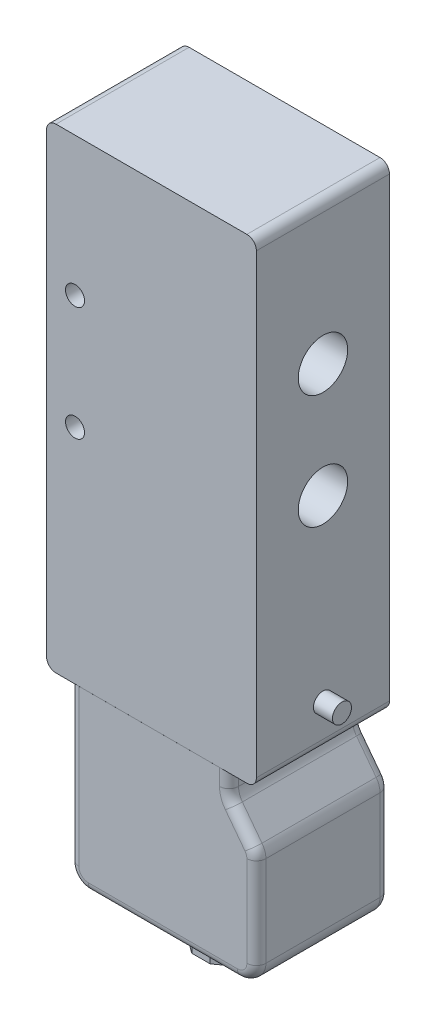
from build123d import *

# Parameters (mm, degrees)
SKETCH2_W           = 35.052
SKETCH2_H           = 79.375
BOSS_EXTRUDE1_DEPTH = 22.225
SKETCH3_R           = 1.5875
BOSS_EXTRUDE2_DEPTH = 3.175
BOSS_EXTRUDE4_DEPTH = 22.225
FILLET2_R           = 3.175
BOSS_EXTRUDE5_DEPTH = 0.00254
BOSS_EXTRUDE6_START = 0.00254
BOSS_EXTRUDE6_DEPTH = 0.00254
BOSS_EXTRUDE7_DEPTH = 6.35
SKETCH8_R           = 7.441189758
SKETCH8_R_2         = 3.175
CUT_EXTRUDE2_DEPTH  = 1.5875
FILLET3_R           = 1.5875
FILLET5_R           = 1.5875
SKETCH9_R           = 4.1275
CUT_EXTRUDE3_DEPTH  = 6.858
SKETCH10_R          = 4.1275
CUT_EXTRUDE4_DEPTH  = 6.858
SKETCH11_R          = 1.5875
CUT_EXTRUDE5_DEPTH  = 91.861200127


with BuildPart() as part:
    # Sketch2 → Boss-Extrude1 (new body)
    with BuildSketch(Plane.XY):
        with Locations((17.526, 39.6875)):
            Rectangle(SKETCH2_W, SKETCH2_H)
    extrude(amount=BOSS_EXTRUDE1_DEPTH)

    # Sketch3 → Boss-Extrude2 (add)
    with BuildSketch(Plane(origin=(35.052, 0, 0), x_dir=(0, 0, -1), z_dir=(1, 0, 0))):
        with Locations(Location((-11.1125, 6.985, 0), (0, 0, 180))):
            Circle(SKETCH3_R)
    extrude(amount=BOSS_EXTRUDE2_DEPTH)

    # Sketch4 → Boss-Extrude4 (add)
    with BuildSketch(Plane.XY.offset(22.225)):
        Polygon((30.48, -3.81), (30.48, 0), (29.21, 0), (3.81, 0), (3.81, -29.21), (35.052, -29.21), (35.052, -9.836099718), align=None)
    extrude(amount=-BOSS_EXTRUDE4_DEPTH)

    # Fillet2
    fillet2_edges = [part.edges().sort_by_distance(p)[0] for p in [
        (30.48, -3.81, 11.1125),
        (35.052, -9.836099718, 11.1125),
        (35.052, -29.21, 11.1125),
        (3.81, -29.21, 11.1125),
    ]]
    fillet(fillet2_edges, radius=FILLET2_R)

    # Sketch5 → Boss-Extrude5 (add)
    with BuildSketch(Plane.XY.offset(22.225)):
        with BuildLine():
            Line((3.81, 0), (30.48, 0))
            Line((30.48, 0), (30.48, -2.741877551))
            ThreePointArc((30.48, -2.741877551), (30.64572555, -3.754247187), (31.125601437, -4.660931461))
            Line((31.125601437, -4.660931461), (34.406398563, -8.985168257))
            ThreePointArc((34.406398563, -8.985168257), (34.88627445, -9.891852531), (35.052, -10.904222168))
            Line((35.052, -10.904222168), (35.052, -26.035))
            ThreePointArc((35.052, -26.035), (34.12206403, -28.28006403), (31.877, -29.21))
            Line((31.877, -29.21), (6.985, -29.21))
            ThreePointArc((6.985, -29.21), (4.73993597, -28.28006403), (3.81, -26.035))
            Line((3.81, -26.035), (3.81, 0))
        make_face()
    extrude(amount=BOSS_EXTRUDE5_DEPTH)

    # Sketch6 → Boss-Extrude6 (add)
    with BuildSketch(Plane(origin=(0, 0, 0), x_dir=(-1, 0, 0), z_dir=(0, 0, -1)).offset(BOSS_EXTRUDE6_START)):
        with BuildLine():
            Line((-30.48, 0), (-3.81, 0))
            Line((-3.81, 0), (-3.81, -26.035))
            ThreePointArc((-3.81, -26.035), (-4.73993597, -28.28006403), (-6.985, -29.21))
            Line((-6.985, -29.21), (-31.877, -29.21))
            ThreePointArc((-31.877, -29.21), (-34.12206403, -28.28006403), (-35.052, -26.035))
            Line((-35.052, -26.035), (-35.052, -10.904222168))
            ThreePointArc((-35.052, -10.904222168), (-34.88627445, -9.891852531), (-34.406398563, -8.985168257))
            Line((-34.406398563, -8.985168257), (-31.125601437, -4.660931461))
            ThreePointArc((-31.125601437, -4.660931461), (-30.64572555, -3.754247187), (-30.48, -2.741877551))
            Line((-30.48, -2.741877551), (-30.48, 0))
        make_face()
    extrude(amount=-BOSS_EXTRUDE6_DEPTH)

    # Sketch7 → Boss-Extrude7 (add)
    with BuildSketch(Plane.XZ.offset(29.21)):
        Polygon((17.890627537, 15.85327897), (15.398252537, 14.042462536), (14.44625, 11.1125), (15.398252537, 8.182537464), (17.890627537, 6.37172103), (20.971372463, 6.37172103), (23.463747463, 8.182537464), (24.41575, 11.1125), (23.463747463, 14.042462536), (20.971372463, 15.85327897), align=None)
    extrude(amount=BOSS_EXTRUDE7_DEPTH)

    # Sketch8 → Cut-Extrude2 (cut)
    # profile 1 of 2: a face of its own
    with BuildSketch(Plane.XZ.offset(29.21)):
        with Locations((19.431, 11.1125)):
            Circle(SKETCH8_R)
        Polygon((14.44625, 11.1125), (15.398252537, 14.042462536), (17.890627537, 15.85327897), (20.971372463, 15.85327897), (23.463747463, 14.042462536), (24.41575, 11.1125), (23.463747463, 8.182537464), (20.971372463, 6.37172103), (17.890627537, 6.37172103), (15.398252537, 8.182537464), align=None, mode=Mode.SUBTRACT)
    # profile 2 of 2: a face of its own
    with BuildSketch(Plane.XZ.offset(29.21)):
        Polygon((15.398252537, 14.042462536), (17.890627537, 15.85327897), (20.971372463, 15.85327897), (23.463747463, 14.042462536), (24.41575, 11.1125), (23.463747463, 8.182537464), (20.971372463, 6.37172103), (17.890627537, 6.37172103), (15.398252537, 8.182537464), (14.44625, 11.1125), align=None)
        with Locations(Location((19.431, 11.1125, 0), (0, 0, 270))):
            Circle(SKETCH8_R_2, mode=Mode.SUBTRACT)
    extrude(amount=CUT_EXTRUDE2_DEPTH, mode=Mode.SUBTRACT)

    # Fillet3
    fillet3_edges = [part.edges().sort_by_distance(p)[0] for p in [
        (0, 79.375, 11.1125),
        (35.052, 79.375, 11.1125),
        (35.052, 0, 11.1125),
        (0, 0, 11.1125),
    ]]
    fillet(fillet3_edges, radius=FILLET3_R)

    # Fillet5
    # the kernel refuses this fillet: 1.5875 mm, written as the material it takes off along each edge
    with BuildSketch(Plane(origin=(30.48, -2.741877551, -0.00254), x_dir=(0, 0, 1), z_dir=(0, 1, 0)), Plane(origin=(30.48, 0, 22.22754), x_dir=(0, 0, -1), z_dir=(0, -1, 0))) as fillet5_piece_1:
        with BuildLine():
            CenterArc((FILLET5_R, -FILLET5_R), FILLET5_R, 90, 90)
            Line((0, -FILLET5_R), (0, 0))
            Line((0, 0), (FILLET5_R, 0))
        make_face()
    extrude(amount=2.741877551, mode=Mode.SUBTRACT)
    with BuildSketch(Plane(origin=(33.655, -2.741877551, -0.00254), x_dir=(-0.7966609646289196, -0.6044264284729114, 0), z_dir=(0.6044264284729114, -0.7966609646289196, 0))) as fillet5_piece_2:
        with BuildLine():
            CenterArc((3.175 + FILLET5_R, -FILLET5_R), FILLET5_R, 90, 90)
            Line((3.175, -FILLET5_R), (3.175, 0))
            Line((3.175, 0), (3.175 + FILLET5_R, 0))
        make_face()
    revolve(axis=Axis((33.655, -2.741877551, -0.00254), (0, 0, -1)), revolution_arc=37.18757939, mode=Mode.SUBTRACT)
    with BuildSketch(Plane(origin=(34.406398563, -8.985168257, -0.00254), x_dir=(-0.796660964628914, -0.6044264284729185, 0), z_dir=(-0.6044264284729186, 0.7966609646289141, 0)), Plane(origin=(31.125601437, -4.660931461, 22.22754), x_dir=(-0.7966609646289139, -0.6044264284729186, 0), z_dir=(0.6044264284729186, -0.796660964628914, 0))) as fillet5_piece_3:
        with BuildLine():
            CenterArc((FILLET5_R, FILLET5_R), FILLET5_R, 180, 90)
            Line((0, FILLET5_R), (0, 0))
            Line((0, 0), (FILLET5_R, 0))
        make_face()
    extrude(amount=5.427951146, mode=Mode.SUBTRACT)
    with BuildSketch(Plane(origin=(31.877, -10.904222168, -0.00254), x_dir=(1, 0, 0), z_dir=(0, -1, 0))) as fillet5_piece_4:
        with BuildLine():
            CenterArc((3.175 - FILLET5_R, FILLET5_R), FILLET5_R, 270, 90)
            Line((3.175, FILLET5_R), (3.175, 0))
            Line((3.175, 0), (3.175 - FILLET5_R, 0))
        make_face()
    revolve(axis=Axis((31.877, -10.904222168, -0.00254), (0, 0, 1)), revolution_arc=37.18757939, mode=Mode.SUBTRACT)
    with BuildSketch(Plane(origin=(35.052, -26.035, -0.00254), x_dir=(-1, 0, 0), z_dir=(0, 1, 0)), Plane(origin=(35.052, -10.904222168, 22.22754), x_dir=(-1, 0, 0), z_dir=(0, -1, 0))) as fillet5_piece_5:
        with BuildLine():
            CenterArc((FILLET5_R, FILLET5_R), FILLET5_R, 180, 90)
            Line((0, FILLET5_R), (0, 0))
            Line((0, 0), (FILLET5_R, 0))
        make_face()
    extrude(amount=15.130777832, mode=Mode.SUBTRACT)
    with BuildSketch(Plane(origin=(31.877, -26.035, -0.00254), x_dir=(0, -1, 0), z_dir=(-1, 0, 0))) as fillet5_piece_6:
        with BuildLine():
            CenterArc((3.175 - FILLET5_R, FILLET5_R), FILLET5_R, 270, 90)
            Line((3.175, FILLET5_R), (3.175, 0))
            Line((3.175, 0), (3.175 - FILLET5_R, 0))
        make_face()
    revolve(axis=Axis((31.877, -26.035, -0.00254), (0, 0, 1)), revolution_arc=90, mode=Mode.SUBTRACT)
    with BuildSketch(Plane(origin=(6.985, -29.21, -0.00254), x_dir=(0, 1, 0), z_dir=(1, 0, 0)), Plane(origin=(31.877, -29.21, 22.22754), x_dir=(0, 1, 0), z_dir=(-1, 0, 0))) as fillet5_piece_7:
        with BuildLine():
            CenterArc((FILLET5_R, FILLET5_R), FILLET5_R, 180, 90)
            Line((0, FILLET5_R), (0, 0))
            Line((0, 0), (FILLET5_R, 0))
        make_face()
    extrude(amount=24.892, mode=Mode.SUBTRACT)
    with BuildSketch(Plane(origin=(6.985, -26.035, -0.00254), x_dir=(-1, 0, 0), z_dir=(0, 1, 0))) as fillet5_piece_8:
        with BuildLine():
            CenterArc((3.175 - FILLET5_R, FILLET5_R), FILLET5_R, 270, 90)
            Line((3.175, FILLET5_R), (3.175, 0))
            Line((3.175, 0), (3.175 - FILLET5_R, 0))
        make_face()
    revolve(axis=Axis((6.985, -26.035, -0.00254), (0, 0, 1)), revolution_arc=90, mode=Mode.SUBTRACT)
    with BuildSketch(Plane(origin=(3.81, 0, -0.00254), x_dir=(0, 0, 1), z_dir=(0, -1, 0)), Plane(origin=(3.81, -26.035, 22.22754), x_dir=(0, 0, -1), z_dir=(0, 1, 0))) as fillet5_piece_9:
        with BuildLine():
            CenterArc((FILLET5_R, -FILLET5_R), FILLET5_R, 90, 90)
            Line((0, -FILLET5_R), (0, 0))
            Line((0, 0), (FILLET5_R, 0))
        make_face()
    extrude(amount=26.035, mode=Mode.SUBTRACT)
    with BuildSketch(Plane(origin=(6.985, -26.035, 22.22754), x_dir=(0, -1, 0), z_dir=(1, 0, 0))) as fillet5_piece_10:
        with BuildLine():
            CenterArc((3.175 - FILLET5_R, FILLET5_R), FILLET5_R, 270, 90)
            Line((3.175, FILLET5_R), (3.175, 0))
            Line((3.175, 0), (3.175 - FILLET5_R, 0))
        make_face()
    revolve(axis=Axis((6.985, -26.035, 22.22754), (0, 0, -1)), revolution_arc=90, mode=Mode.SUBTRACT)
    with BuildSketch(Plane(origin=(31.877, -26.035, 22.22754), x_dir=(1, 0, 0), z_dir=(0, 1, 0))) as fillet5_piece_11:
        with BuildLine():
            CenterArc((3.175 - FILLET5_R, FILLET5_R), FILLET5_R, 270, 90)
            Line((3.175, FILLET5_R), (3.175, 0))
            Line((3.175, 0), (3.175 - FILLET5_R, 0))
        make_face()
    revolve(axis=Axis((31.877, -26.035, 22.22754), (0, 0, -1)), revolution_arc=90, mode=Mode.SUBTRACT)
    with BuildSketch(Plane(origin=(31.877, -10.904222168, 22.22754), x_dir=(0.7966609646289129, 0.6044264284729202, 0), z_dir=(-0.6044264284729202, 0.7966609646289129, 0))) as fillet5_piece_12:
        with BuildLine():
            CenterArc((3.175 - FILLET5_R, FILLET5_R), FILLET5_R, 270, 90)
            Line((3.175, FILLET5_R), (3.175, 0))
            Line((3.175, 0), (3.175 - FILLET5_R, 0))
        make_face()
    revolve(axis=Axis((31.877, -10.904222168, 22.22754), (0, 0, -1)), revolution_arc=37.18757939, mode=Mode.SUBTRACT)
    with BuildSketch(Plane(origin=(33.655, -2.741877551, 22.22754), x_dir=(-1, 0, 0), z_dir=(0, 1, 0))) as fillet5_piece_13:
        with BuildLine():
            CenterArc((3.175 + FILLET5_R, -FILLET5_R), FILLET5_R, 90, 90)
            Line((3.175, -FILLET5_R), (3.175, 0))
            Line((3.175, 0), (3.175 + FILLET5_R, 0))
        make_face()
    revolve(axis=Axis((33.655, -2.741877551, 22.22754), (0, 0, 1)), revolution_arc=37.18757939, mode=Mode.SUBTRACT)

    # Sketch9 → Cut-Extrude3 (cut)
    with BuildSketch(Plane(origin=(35.052, 0, 0), x_dir=(0, 0, -1), z_dir=(1, 0, 0))):
        with Locations((-11.1125, 55.88)):
            Circle(SKETCH9_R)
        with Locations((-11.1125, 36.83)):
            Circle(SKETCH9_R)
    extrude(amount=-CUT_EXTRUDE3_DEPTH, mode=Mode.SUBTRACT)

    # Sketch10 → Cut-Extrude4 (cut)
    with BuildSketch(Plane.ZY):
        with Locations((11.1125, 65.7225)):
            Circle(SKETCH10_R)
        with Locations((11.1125, 46.6725)):
            Circle(SKETCH10_R)
        with Locations((11.1125, 27.6225)):
            Circle(SKETCH10_R)
    extrude(amount=-CUT_EXTRUDE4_DEPTH, mode=Mode.SUBTRACT)

    # Sketch11 → Cut-Extrude5 (cut, through all)
    with BuildSketch(Plane.XY.offset(22.225)):
        with Locations((4.7625, 56.1975)):
            Circle(SKETCH11_R)
        with Locations((4.7625, 37.1475)):
            Circle(SKETCH11_R)
    extrude(amount=-CUT_EXTRUDE5_DEPTH, mode=Mode.SUBTRACT)


solid = part.part
